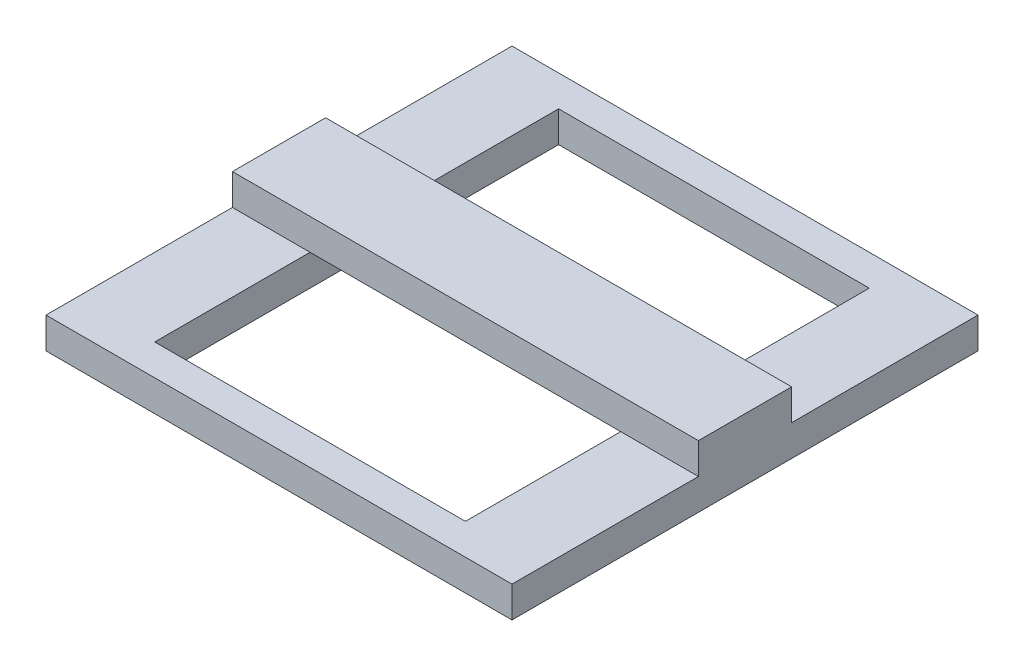
from build123d import *

# Parameters (mm, degrees)
SKETCH1_W           = 150
SKETCH1_H           = 30
BOSS_EXTRUDE1_DEPTH = 10
SKETCH9_W           = 150
SKETCH9_H           = 150
SKETCH9_W_2         = 100
SKETCH9_H_2         = 130
BOSS_EXTRUDE3_DEPTH = 10


with BuildPart() as part:
    # Sketch1 → Boss-Extrude1 (new body)
    with BuildSketch(Plane(origin=(0, 0, 0), x_dir=(1, 0, 0), z_dir=(0, 1, 0))):
        with Locations((-75, 15)):
            Rectangle(SKETCH1_W, SKETCH1_H)
    extrude(amount=BOSS_EXTRUDE1_DEPTH)

    # Sketch9 → Boss-Extrude3 (add)
    with BuildSketch(Plane.XZ):
        with Locations((-75, -15)):
            Rectangle(SKETCH9_W, SKETCH9_H)
        with Locations((-75, -15)):
            Rectangle(SKETCH9_W_2, SKETCH9_H_2, mode=Mode.SUBTRACT)
    extrude(amount=BOSS_EXTRUDE3_DEPTH)


solid = part.part
